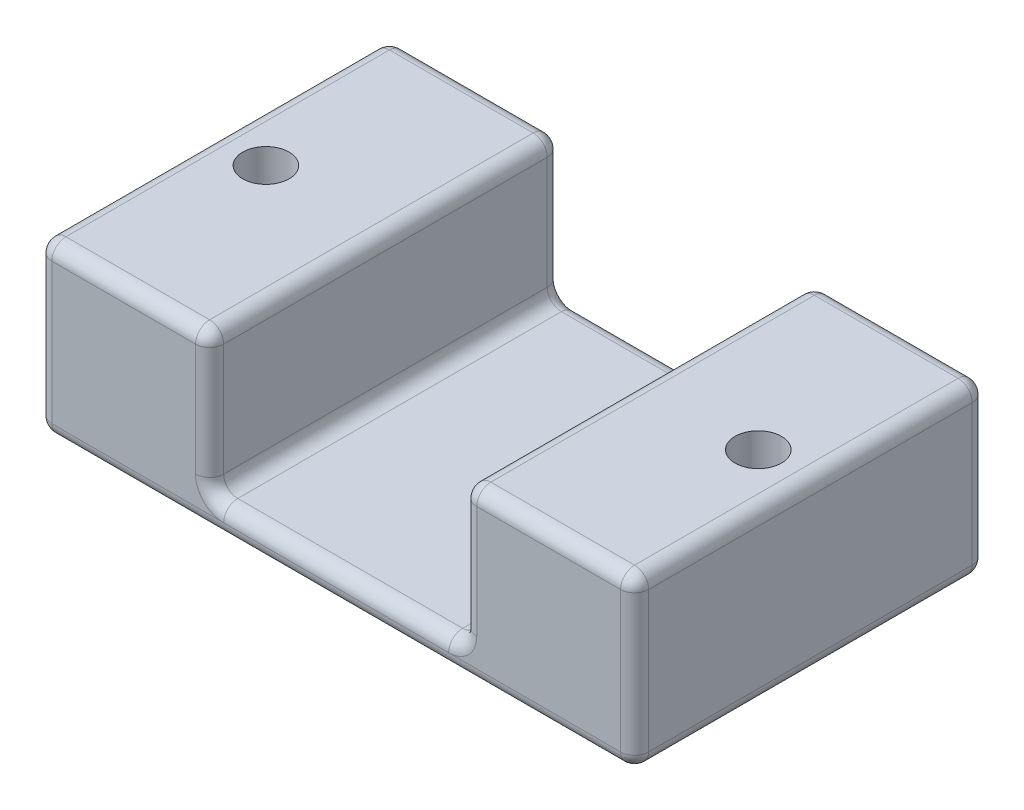
from build123d import *

# Parameters (mm, degrees)
SKETCH_1_W           = 42.43
SKETCH_1_H           = 25
EXTRUDE_1_DEPTH      = 2
SKETCH_2_W           = 12.22
SKETCH_2_H           = 25
EXTRUDE_2_DEPTH      = 10
SKETCH_3_R           = 1.65
CUT_EXTRUDE_1_DEPTH  = 28.392083254
EXTRUDE_3_DEPTH      = 3
EXTRUDE_3_DEPTH_BACK = 3
FILLET_2_R           = 1
SKETCH_5_R           = 3.25
CUT_EXTRUDE_2_DEPTH  = 3


with BuildPart() as part:
    # ｽｹｯﾁ1 → ﾎﾞｽ - 押し出し1 (new body)
    with BuildSketch(Plane(origin=(0, 0, 0), x_dir=(1, 0, 0), z_dir=(0, 1, 0))):
        Rectangle(SKETCH_1_W, SKETCH_1_H)
    extrude(amount=EXTRUDE_1_DEPTH)

    # ｽｹｯﾁ2 → ﾎﾞｽ - 押し出し2 (add)
    with BuildSketch(Plane(origin=(0, 2, 0), x_dir=(1, 0, 0), z_dir=(0, 1, 0))):
        with Locations((-15.105, 0)):
            Rectangle(SKETCH_2_W, SKETCH_2_H)
        with Locations((15.105, 0)):
            Rectangle(SKETCH_2_W, SKETCH_2_H)
    extrude(amount=EXTRUDE_2_DEPTH)

    # ｽｹｯﾁ3 → ｶｯﾄ - 押し出し1 (cut, through all)
    with BuildSketch(Plane(origin=(0, 12, 0), x_dir=(1, 0, 0), z_dir=(0, 1, 0))):
        with Locations(Location((-17.495, 0, 0), (0, 0, 270))):
            Circle(SKETCH_3_R)
        with Locations(Location((17.505, 0, 0), (0, 0, 270))):
            Circle(SKETCH_3_R)
    extrude(amount=-CUT_EXTRUDE_1_DEPTH, mode=Mode.SUBTRACT)

    # ｽｹｯﾁ4 → ﾎﾞｽ - 押し出し3 (add, two sides: drawn at the far end of the back side and taken through both)
    with BuildSketch(Plane.XY.offset(-EXTRUDE_3_DEPTH_BACK)):
        Polygon((-11.995, 0), (-8.995, -3), (8.995, -3), (11.995, 0), align=None)
    extrude(amount=EXTRUDE_3_DEPTH + EXTRUDE_3_DEPTH_BACK)

    # ﾌｨﾚｯﾄ2
    fillet_2_edges = [part.edges().sort_by_distance(p)[0] for p in [
        (0, 2, 12.5),
        (-8.995, 2, 0),
        (-8.995, 7, 12.5),
        (-8.995, 7, -12.5),
        (-21.215, 12, 0),
        (-15.105, 12, 12.5),
        (-8.995, 12, 0),
        (-15.105, 12, -12.5),
        (0, 2, -12.5),
        (8.995, 2, 0),
        (8.995, 7, -12.5),
        (8.995, 7, 12.5),
        (21.215, 12, 0),
        (15.105, 12, -12.5),
        (8.995, 12, 0),
        (15.105, 12, 12.5),
        (-8.995, -3, 0),
        (-11.995, 0, 0),
        (0, 0, 3),
        (11.995, 0, 0),
        (0, 0, 12.5),
        (8.995, -3, 0),
        (0, -3, -3),
        (0, 0, -3),
        (0, -3, 3),
        (-21.215, 0, 0),
        (0, 0, -12.5),
        (21.215, 0, 0),
        (21.215, 6, 12.5),
        (-21.215, 6, 12.5),
        (-21.215, 6, -12.5),
        (21.215, 6, -12.5),
    ]]
    fillet(fillet_2_edges, radius=FILLET_2_R - 0.0001)  # a hair under: the kernel refuses the full size

    # ｽｹｯﾁ5 → ｶｯﾄ - 押し出し2 (cut)
    with BuildSketch(Plane(origin=(0, 0, 0), x_dir=(-1, 0, 0), z_dir=(0, -1, 0))):
        with Locations(Location((-17.505, 0, 0), (0, 0, 90))):
            Circle(SKETCH_5_R)
        with Locations(Location((17.495, 0, 0), (0, 0, 90))):
            Circle(SKETCH_5_R)
    extrude(amount=-CUT_EXTRUDE_2_DEPTH, mode=Mode.SUBTRACT)


solid = part.part
